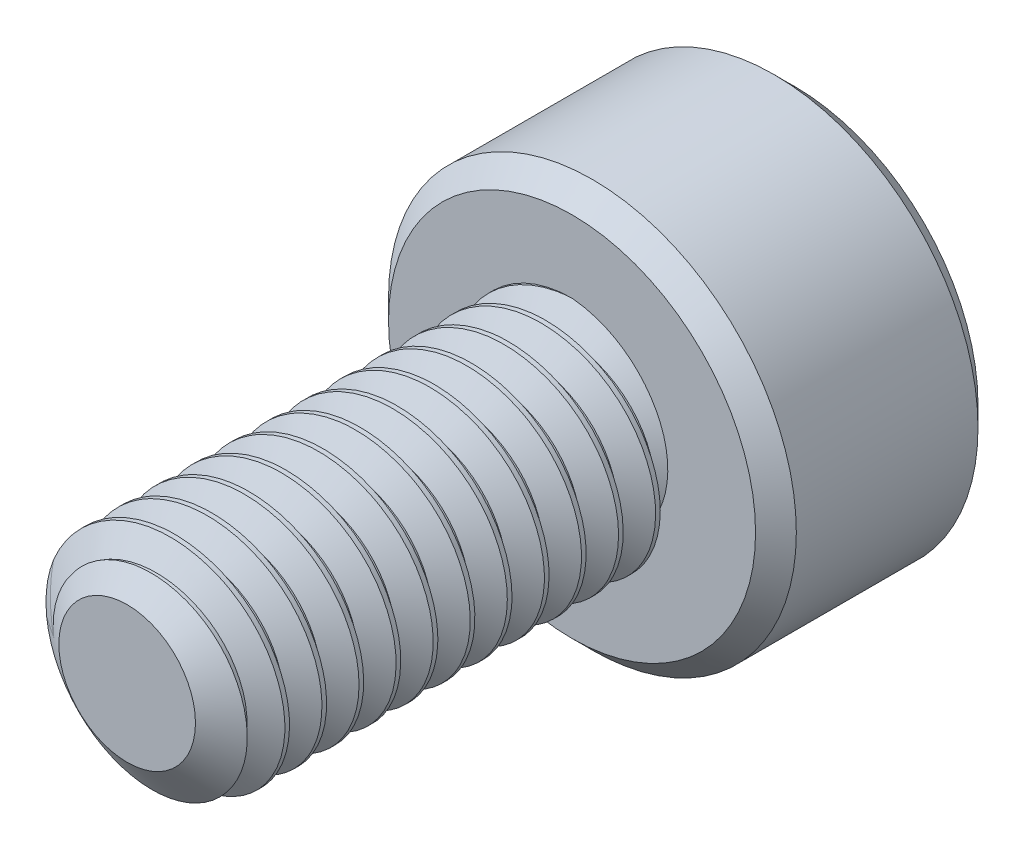
from build123d import *

# Parameters (mm, degrees)
SKETCH1_R          = 1.5
EXTRUDE1_DEPTH     = 6
CUT_SWEEP1_PITCH   = 0.5
SKETCH6_R          = 2.75
EXTRUDE2_DEPTH     = 3
CUT_EXTRUDE1_DEPTH = 1.875
CHAMFER1_SIZE      = 0.275


with BuildPart() as part:
    # Sketch1 → Extrude1 (new body)
    with BuildSketch(Plane.XY):
        Circle(SKETCH1_R)
    extrude(amount=-EXTRUDE1_DEPTH)

    # Cut-Sweep1: the profile of Sketch3 profile screwed along a right-hand helix of 13 turns, 6 arcs to a turn; built about Z, then put on its axis
    cut_sweep1_z = Axis((0, 0, 0), (0, 0, 1))
    cut_sweep1_corners = [(1.5003, 0, -0.437673205), (1.175240474, 0, -0.25), (1.175240474, 0, -0.1875), (1.5003, 0, 0.000173205)]
    with BuildLine(mode=Mode.PRIVATE) as cut_sweep1_profile:
        Line(cut_sweep1_corners[0], cut_sweep1_corners[1])
        Line(cut_sweep1_corners[1], cut_sweep1_corners[2])
        Line(cut_sweep1_corners[2], cut_sweep1_corners[3])
        Line(cut_sweep1_corners[3], cut_sweep1_corners[0])
    cut_sweep1_cap = Face(cut_sweep1_profile.wire())
    cut_sweep1_turn_angles = [0, 30, 60, 90, 120, 150, 180, 210, 240, 270, 300, 330, 360]
    cut_sweep1_turn_weights = [1, 0.8660254037844387, 1, 0.8660254037844387, 1, 0.8660254037844387, 1, 0.8660254037844387, 1, 0.8660254037844387, 1, 0.8660254037844387, 1]
    cut_sweep1_turn_rails = [Edge.make_bspline([Vector(p[0], p[1], 0).rotate(cut_sweep1_z, cut_sweep1_turn_angles[k]) / cut_sweep1_turn_weights[k] + Vector(0, 0, p[2] + CUT_SWEEP1_PITCH * cut_sweep1_turn_angles[k] / 360) for k in range(13)], [0, 0, 0, 1, 1, 2, 2, 3, 3, 4, 4, 5, 5, 6, 6, 6], 2, cut_sweep1_turn_weights) for p in cut_sweep1_corners]
    cut_sweep1_turn_sides = [Face.make_surface_from_curves(cut_sweep1_turn_rails[p[0]], cut_sweep1_turn_rails[p[1]]) for p in [(0, 1), (1, 2), (2, 3), (3, 0)]]
    cut_sweep1 = Plane(origin=(0, 0, 0), x_dir=(0, 1, 0), z_dir=(0, 0, -1)) * Solid(Shell([*[p.moved(Location((0, 0, CUT_SWEEP1_PITCH * i))) for i in range(13) for p in cut_sweep1_turn_sides], cut_sweep1_cap, cut_sweep1_cap.rotate(cut_sweep1_z, 4680).moved(Location((0, 0, CUT_SWEEP1_PITCH * 4680 / 360)))]))
    add(cut_sweep1, mode=Mode.SUBTRACT)

    # Sketch4 → Cut-Revolve1 (revolve, cut)
    with BuildSketch(Plane(origin=(0, 0, 0), x_dir=(0, 0, -1), z_dir=(1, 0, 0)), mode=Mode.PRIVATE) as cut_revolve1_sk:
        Polygon((0.405251783, 1.5), (0, 0.921240474), (0, 1.5), align=None)
    revolve(cut_revolve1_sk.sketch.rotate(Axis((0, 0, 0), (0, 0, -1)), 263.352109169), axis=Axis((0, 0, 0), (0, 0, -1)), mode=Mode.SUBTRACT)

    # Sketch6 → Extrude2 (add)
    with BuildSketch(Plane(origin=(0, 0, -6), x_dir=(-1, 0, 0), z_dir=(0, 0, -1))):
        Circle(SKETCH6_R)
    extrude(amount=EXTRUDE2_DEPTH)

    # Sketch7 → Cut-Extrude1 (cut)
    with BuildSketch(Plane(origin=(0, 0, -9), x_dir=(-1, 0, 0), z_dir=(0, 0, -1))):
        Polygon((0, 1.443375673), (-1.25, 0.721687836), (-1.25, -0.721687836), (0, -1.443375673), (1.25, -0.721687836), (1.25, 0.721687836), align=None)
    extrude(amount=-CUT_EXTRUDE1_DEPTH, mode=Mode.SUBTRACT)

    # Cut-Extrude2 cone 1 section (through the dimple's axis) → Cut-Extrude2 (revolve, cut)
    with BuildSketch(Plane(origin=(0, 0, -9), x_dir=(0, 1, 0), z_dir=(1, 0, 0))):
        Polygon((0, 0), (1.443375673, 0), (0, 1.443375673), align=None)
    revolve(axis=Axis((0, 0, -9), (0, 0, 1)), mode=Mode.SUBTRACT)

    # Chamfer1
    chamfer1_edges = [part.edges().sort_by_distance(p)[0] for p in [
        (2.75, 0, -6),
        (2.75, 0, -9),
    ]]
    chamfer(chamfer1_edges, length=CHAMFER1_SIZE)


solid = part.part
